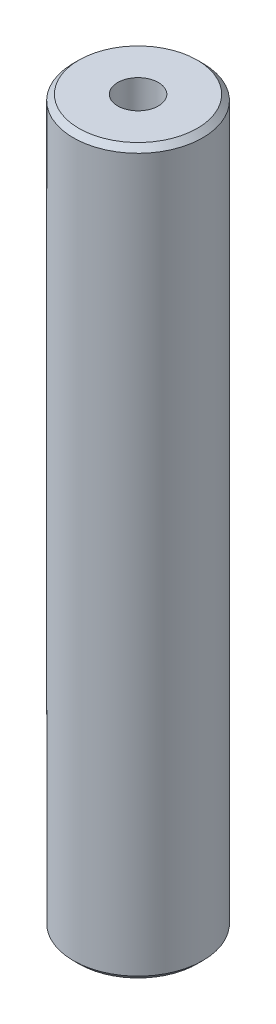
from build123d import *

# Parameters (mm, degrees)
SKETCH1_R           = 15
BOSS_EXTRUDE1_DEPTH = 167.896019458
SKETCH2_R           = 4.724130451
CUT_EXTRUDE1_DEPTH  = 170.230828603
CHAMFER1_SIZE       = 1.267713179


with BuildPart() as part:
    # Sketch1 → Boss-Extrude1 (new body)
    with BuildSketch(Plane(origin=(0, 0, 0), x_dir=(1, 0, 0), z_dir=(0, 1, 0))):
        Circle(SKETCH1_R)
    extrude(amount=BOSS_EXTRUDE1_DEPTH)

    # Sketch2 → Cut-Extrude1 (cut, through all)
    with BuildSketch(Plane(origin=(0, 0, 0), x_dir=(1, 0, 0), z_dir=(0, 1, 0))):
        Circle(SKETCH2_R)
    extrude(amount=CUT_EXTRUDE1_DEPTH, mode=Mode.SUBTRACT)

    # Chamfer1
    chamfer1_edges = [part.edges().sort_by_distance(p)[0] for p in [
        (-15, 167.896019458, 0),
        (-15, 0, 0),
    ]]
    chamfer(chamfer1_edges, length=CHAMFER1_SIZE)


solid = part.part
